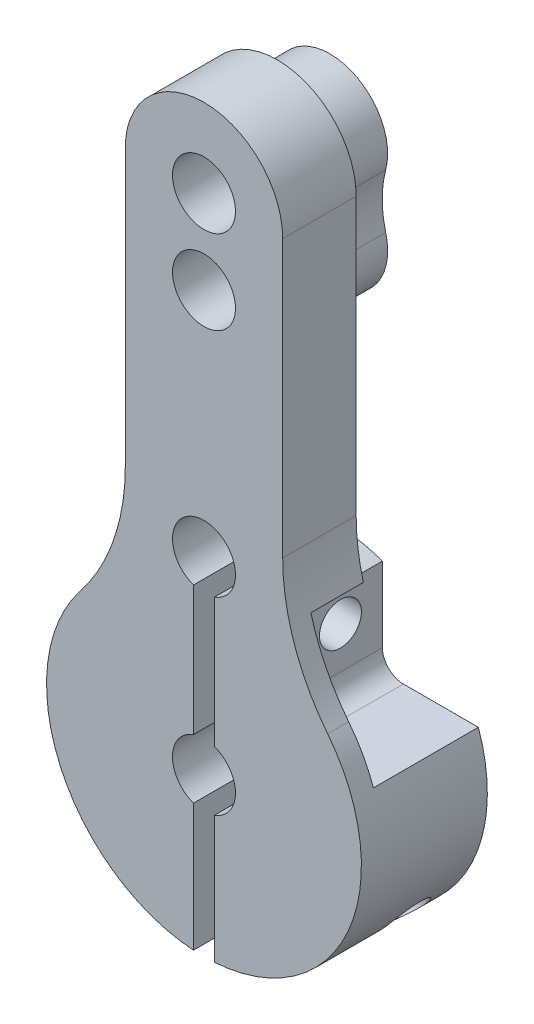
from build123d import *

# Parameters (mm, degrees)
SKETCH_1_R               = 7.5
EXTRUDE_1_DEPTH          = 6
FILLET_1_R               = 10
SKETCH_2_R               = 1.5
SKETCH_2_R_2             = 3
CUT_EXTRUDE_1_DEPTH      = 3.5
CUT_EXTRUDE_2_DEPTH      = 29.957943642
CUT_EXTRUDE_2_DEPTH_BACK = 29.957943642
SKETCH_3_R               = 1.5
CUT_EXTRUDE_3_DEPTH      = 30.365157926
CUT_EXTRUDE_3_DEPTH_BACK = 2.5
CUT_EXTRUDE_START        = -5
CUT_EXTRUDE_4_DEPTH      = 5
CUT_EXTRUDE_5_DEPTH      = 31.10087208
CUT_EXTRUDE_5_DEPTH_BACK = 31.10087208
SKETCH_6_R               = 1
CUT_EXTRUDE_6_DEPTH      = 31.1008721
CUT_EXTRUDE_6_DEPTH_BACK = 31.1008721
SKETCH_7_R               = 1


# Read off the part's stored shape, not the designer's step: 除料-伸長4
with BuildPart() as part:
    # 草圖1 → 填料-伸長1 (new body)
    with BuildSketch(Plane.XY):
        Circle(SKETCH_1_R)
        with BuildLine():
            Line((-3.75, 0), (-3.75, 24))
            ThreePointArc((-3.75, 24), (0, 27.75), (3.75, 24))
            Line((3.75, 24), (3.75, 0))
            ThreePointArc((3.75, 0), (0, -3.75), (-3.75, 0))
        make_face()
    extrude(amount=EXTRUDE_1_DEPTH)

    # 圓角1
    fillet_1_edges = [part.edges().sort_by_distance(p)[0] for p in [
        (-3.75, 6.495190528, 3),
        (3.75, 6.495190528, 3),
    ]]
    fillet(fillet_1_edges, radius=FILLET_1_R)

    # 草圖2 → 除料-伸長1 (cut)
    with BuildSketch(Plane(origin=(0, 0, 0), x_dir=(-1, 0, 0), z_dir=(0, 0, -1))):
        with Locations((0, 24)):
            Circle(SKETCH_2_R)
        Circle(SKETCH_2_R_2)
    extrude(amount=-CUT_EXTRUDE_1_DEPTH, mode=Mode.SUBTRACT)

    # 草圖3 → 除料-伸長2 (cut, two sides: drawn at the far end of the back side and taken through both)
    with BuildSketch(Plane(origin=(0, 0, 3.5), x_dir=(-1, 0, 0), z_dir=(0, 0, -1)).offset(-CUT_EXTRUDE_2_DEPTH_BACK)):
        with BuildLine():
            Line((-0.5, 7.585786438), (-0.5, 1.414213562))
            ThreePointArc((-0.5, 1.414213562), (-1.5, 0), (-0.5, -1.414213562))
            Line((-0.5, -1.414213562), (-0.5, -8))
            ThreePointArc((-0.5, -8), (0, -8.5), (0.5, -8))
            Line((0.5, -8), (0.5, -1.414213562))
            ThreePointArc((0.5, -1.414213562), (1.5, 0), (0.5, 1.414213562))
            Line((0.5, 1.414213562), (0.5, 7.585786438))
            ThreePointArc((0.5, 7.585786438), (0, 10.5), (-0.5, 7.585786438))
        make_face()
        with Locations((0, 24)):
            Circle(SKETCH_3_R)
        with Locations((0, 20)):
            Circle(SKETCH_3_R)
    extrude(amount=CUT_EXTRUDE_2_DEPTH + CUT_EXTRUDE_2_DEPTH_BACK, mode=Mode.SUBTRACT)

    # 草圖4 → 除料-伸長3 (cut, two sides: drawn at the far end of the back side and taken through both)
    with BuildSketch(Plane(origin=(0, 0, 0), x_dir=(-1, 0, 0), z_dir=(0, 0, -1)).offset(-CUT_EXTRUDE_3_DEPTH_BACK)):
        with BuildLine():
            Line((0.5, 7.585786438), (0.5, 7.483314774))
            ThreePointArc((0.5, 7.483314774), (3.498440712, 6.634072097), (5.892857143, 4.639421806))
            ThreePointArc((5.892857143, 4.639421806), (4.300888175, 7.552049194), (3.75, 10.825317547))
            Line((3.75, 10.825317547), (3.75, 24))
            ThreePointArc((3.75, 24), (0, 27.75), (-3.75, 24))
            Line((-3.75, 24), (-3.75, 10.825317547))
            ThreePointArc((-3.75, 10.825317547), (-4.300888175, 7.552049194), (-5.892857143, 4.639421806))
            ThreePointArc((-5.892857143, 4.639421806), (-3.498440712, 6.634072097), (-0.5, 7.483314774))
            Line((-0.5, 7.483314774), (-0.5, 7.585786438))
            ThreePointArc((-0.5, 7.585786438), (0, 10.5), (0.5, 7.585786438))
        make_face()
        with BuildLine():
            ThreePointArc((-2.656851136, 23.290322581), (0, 26.75), (2.656851136, 23.290322581))
            ThreePointArc((2.656851136, 23.290322581), (2.487489566, 22), (2.656851136, 20.709677419))
            ThreePointArc((2.656851136, 20.709677419), (0, 17.25), (-2.656851136, 20.709677419))
            ThreePointArc((-2.656851136, 20.709677419), (-2.487489566, 22), (-2.656851136, 23.290322581))
        make_face(mode=Mode.SUBTRACT)
    extrude(amount=CUT_EXTRUDE_3_DEPTH + CUT_EXTRUDE_3_DEPTH_BACK, mode=Mode.SUBTRACT)

    # 除料-伸長4 outline → 除料-伸長4 (cut)
    with BuildSketch(Plane(origin=(0, 0, 0), x_dir=(-1, 0, 0), z_dir=(0, 0, -1)).offset(CUT_EXTRUDE_START)):
        with BuildLine():
            ThreePointArc((-4.090898557, 8.23654191), (-4.80910956, 6.346425035), (-5.892857143, 4.639421806))
            ThreePointArc((-5.892857143, 4.639421806), (-6.569636137, 3.617994061), (-7.071067812, 2.5))
            Line((-7.071067812, 2.5), (-3.5, 2.5))
            ThreePointArc((-3.5, 2.5), (-2.792893219, 2.792893219), (-2.5, 3.5))
            Line((-2.5, 3.5), (-2.5, 7.071067812))
            ThreePointArc((-2.5, 7.071067812), (-3.250743509, 7.714829249), (-4.090898557, 8.23654191))
        make_face()
        with BuildLine():
            Line((7.071067812, -2.5), (3.5, -2.5))
            ThreePointArc((3.5, -2.5), (2.792893219, -2.792893219), (2.5, -3.5))
            Line((2.5, -3.5), (2.5, -7.071067812))
            ThreePointArc((2.5, -7.071067812), (5.303300859, -5.303300859), (7.071067812, -2.5))
        make_face()
    extrude(amount=CUT_EXTRUDE_4_DEPTH, mode=Mode.SUBTRACT)

    # 草圖6 → 除料-伸長5 (cut, two sides: drawn at the far end of the back side and taken through both)
    with BuildSketch(Plane.ZY.offset(2.5).offset(-CUT_EXTRUDE_5_DEPTH_BACK)):
        with Locations((2, -5.071067812)):
            Circle(SKETCH_6_R)
    extrude(amount=CUT_EXTRUDE_5_DEPTH + CUT_EXTRUDE_5_DEPTH_BACK, mode=Mode.SUBTRACT)

    # 草圖7 → 除料-伸長6 (cut, two sides: drawn at the far end of the back side and taken through both)
    with BuildSketch(Plane(origin=(2.5, 0, 0), x_dir=(0, 0, -1), z_dir=(1, 0, 0)).offset(-CUT_EXTRUDE_6_DEPTH_BACK)):
        with Locations(Location((-2, 5.483314774, 0), (0, 0, 90))):
            Circle(SKETCH_7_R)
    extrude(amount=CUT_EXTRUDE_6_DEPTH + CUT_EXTRUDE_6_DEPTH_BACK, mode=Mode.SUBTRACT)


solid = part.part
